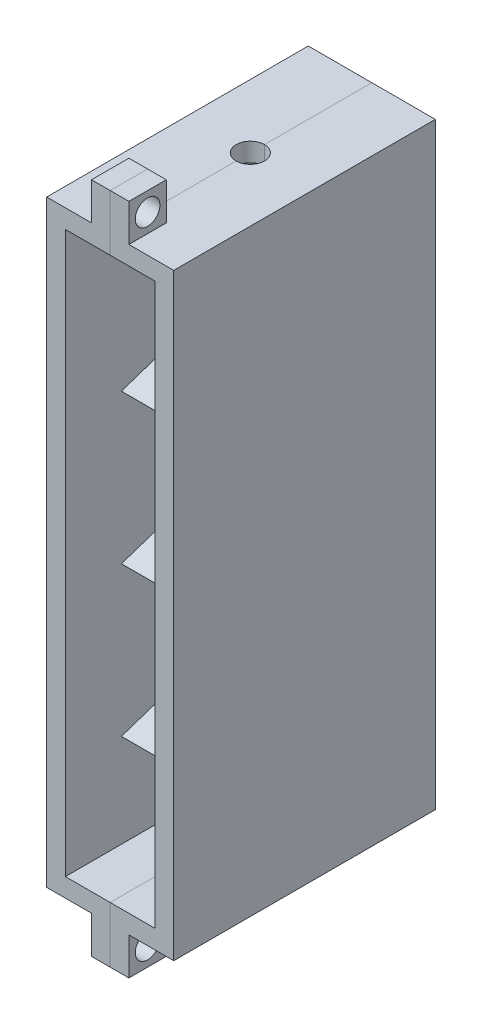
from build123d import *

# Parameters (mm, degrees)
SKETCH1_W           = 17
SKETCH1_H           = 35
BOSS_EXTRUDE1_DEPTH = 80
CAVITY1_START       = -10.314070352
CAVITY1_DEPTH       = 12
SKETCH2_W           = 5
SKETCH2_H           = 5
BOSS_EXTRUDE2_DEPTH = 5
SKETCH3_R           = 1.65
CUT_EXTRUDE1_DEPTH  = 5
CUT_EXTRUDE2_REACH  = 90.343
SKETCH4_R           = 1.9


# Read off the part's stored shape, not the designer's step: Cavity1
with BuildPart() as part:
    # Sketch1 → Boss-Extrude1 (new body)
    with BuildSketch(Plane(origin=(0, 0, 0), x_dir=(1, 0, 0), z_dir=(0, 1, 0))):
        with Locations((-4.314070352, 2.876884422)):
            Rectangle(SKETCH1_W, SKETCH1_H)
    extrude(amount=BOSS_EXTRUDE1_DEPTH)

    # Cavity1 outline → Cavity1 (cut)
    with BuildSketch(Plane.YZ.offset(CAVITY1_START)):
        Polygon((42.5, -15.376884422), (47.5, -15.376884422), (55, 7.123115578), (62.5, -15.376884422), (77.5, -15.376884422), (77.5, 14.623115578), (2.5, 14.623115578), (2.5, -15.376884422), (7.5, -15.376884422), (15, 7.123115578), (22.5, -15.376884422), (27.5, -15.376884422), (35, 7.123115578), align=None)
    extrude(amount=CAVITY1_DEPTH, mode=Mode.SUBTRACT)

    # Sketch2 → Boss-Extrude2 (add)
    with BuildSketch(Plane(origin=(0, 0, 0), x_dir=(1, 0, 0), z_dir=(0, 1, 0))):
        with Locations((-4.314070352, -12.123115578)):
            Rectangle(SKETCH2_W, SKETCH2_H)
    boss_extrude2 = extrude(amount=-BOSS_EXTRUDE2_DEPTH)

    # Sketch3 → Cut-Extrude1 (cut)
    with BuildSketch(Plane.ZY.offset(6.814070352)):
        with Locations((12.123115578, -2.5)):
            Circle(SKETCH3_R)
    cut_extrude1 = extrude(amount=-CUT_EXTRUDE1_DEPTH, mode=Mode.SUBTRACT)

    # Cut-Extrude2: up to this face of the body (flat: up to its plane)
    cut_extrude2_end = Plane(part.part.faces().sort_by_distance((-4.314070352, 0, -3.534779159))[0])
    # Sketch4 → Cut-Extrude2 (cut, up to the picked face)
    with BuildSketch(Plane(origin=(0, 80, 0), x_dir=(1, 0, 0), z_dir=(0, 1, 0)), mode=Mode.PRIVATE) as cut_extrude2_sk1:
        with Locations(Location((-4.314070352, 4.126884422, 0), (0, 0, 270))):
            Circle(SKETCH4_R)
    cut_extrude2_tool1 = split(extrude(cut_extrude2_sk1.sketch, amount=-CUT_EXTRUDE2_REACH, mode=Mode.PRIVATE), bisect_by=cut_extrude2_end, keep=Keep.BOTH, mode=Mode.PRIVATE)
    add(cut_extrude2_tool1.solids().sort_by(Axis((-4.31407, 80, -4.126884), (0, -1, 0)))[0], mode=Mode.SUBTRACT)

    # Mirror1: Boss-Extrude2, Cut-Extrude1 across plane
    add(boss_extrude2.mirror(Plane.ZX.offset(40)))
    add(cut_extrude1.mirror(Plane.ZX.offset(40)), mode=Mode.SUBTRACT)


with BuildPart() as body_2:
    # Split1: the piece on the far side of the plane
    add(part.part)
    split(bisect_by=Plane(origin=(-4.314070352, 0, 0), x_dir=(0, 0, 1), z_dir=(1, 0, 0)), keep=Keep.BOTTOM)


with BuildPart() as part_1:
    add(part.part)

    # Split1
    split(bisect_by=Plane(origin=(-4.314070352, 0, 0), x_dir=(0, 0, 1), z_dir=(1, 0, 0)), keep=Keep.TOP)


solid = Compound([body_2.part, part_1.part])
